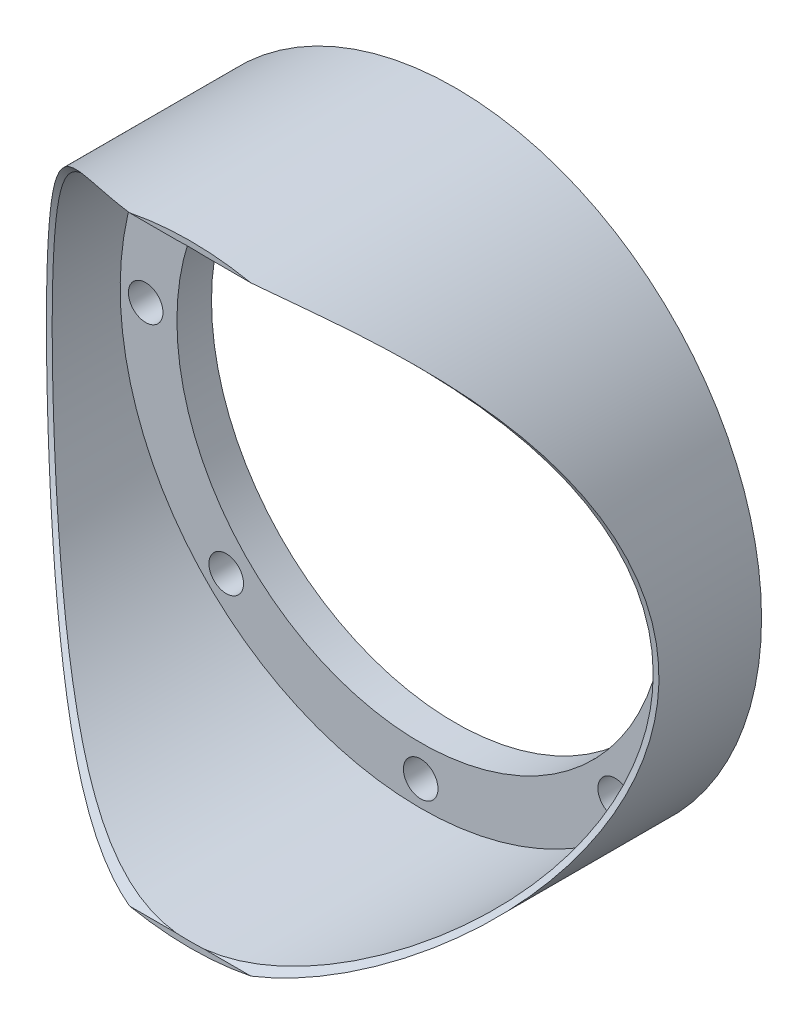
from build123d import *

# Parameters (mm, degrees)
SKETCH1_R           = 265.7
SKETCH1_R_2         = 211.5
SKETCH1_R_3         = 20
SKETCH1_R_4         = 5
EXTRUDE1_DEPTH      = 5
SKETCH2_R           = 265.7
SKETCH2_R_2         = 15
SKETCH2_R_3         = 211.5
EXTRUDE2_DEPTH      = 25
SKETCH3_R           = 265.7
SKETCH3_R_2         = 260.7
EXTRUDE3_DEPTH      = 200
EXTRUDE4_DEPTH      = 441.559848375
EXTRUDE4_DEPTH_BACK = 441.559848375
SKETCH4_R           = 311


with BuildPart() as part:
    # Sketch1 → Extrude1 (new body)
    with BuildSketch(Plane.XY):
        Circle(SKETCH1_R)
        Circle(SKETCH1_R_2, mode=Mode.SUBTRACT)
        with Locations((238.6, 0)):
            Circle(SKETCH1_R_3, mode=Mode.SUBTRACT)
        with Locations((168.715677991, 168.715677991)):
            Circle(SKETCH1_R_3, mode=Mode.SUBTRACT)
        with Locations((0, 238.6)):
            Circle(SKETCH1_R_3, mode=Mode.SUBTRACT)
        with Locations((-168.715677991, 168.715677991)):
            Circle(SKETCH1_R_3, mode=Mode.SUBTRACT)
        with Locations((-238.6, 0)):
            Circle(SKETCH1_R_3, mode=Mode.SUBTRACT)
        with Locations((-168.715677991, -168.715677991)):
            Circle(SKETCH1_R_3, mode=Mode.SUBTRACT)
        with Locations((0, -238.6)):
            Circle(SKETCH1_R_3, mode=Mode.SUBTRACT)
        with Locations((168.715677991, -168.715677991)):
            Circle(SKETCH1_R_3, mode=Mode.SUBTRACT)
        with Locations((230.469902153, 61.754224161)):
            Circle(SKETCH1_R_4, mode=Mode.SUBTRACT)
        with Locations((-230.469902153, 61.754224161)):
            Circle(SKETCH1_R_4, mode=Mode.SUBTRACT)
        with Locations((-91.308266962, -220.437656457)):
            Circle(SKETCH1_R_4, mode=Mode.SUBTRACT)
    extrude(amount=EXTRUDE1_DEPTH)

    # Sketch2 → Extrude2 (add)
    with BuildSketch(Plane.XY.offset(5)):
        Circle(SKETCH2_R)
        with Locations((238.6, 0)):
            Circle(SKETCH2_R_2, mode=Mode.SUBTRACT)
        with Locations((168.715677991, 168.715677991)):
            Circle(SKETCH2_R_2, mode=Mode.SUBTRACT)
        with Locations((0, 238.6)):
            Circle(SKETCH2_R_2, mode=Mode.SUBTRACT)
        with Locations((-168.715677991, 168.715677991)):
            Circle(SKETCH2_R_2, mode=Mode.SUBTRACT)
        with Locations((-238.6, 0)):
            Circle(SKETCH2_R_2, mode=Mode.SUBTRACT)
        with Locations((-168.715677991, -168.715677991)):
            Circle(SKETCH2_R_2, mode=Mode.SUBTRACT)
        with Locations((0, -238.6)):
            Circle(SKETCH2_R_2, mode=Mode.SUBTRACT)
        with Locations((168.715677991, -168.715677991)):
            Circle(SKETCH2_R_2, mode=Mode.SUBTRACT)
        Circle(SKETCH2_R_3, mode=Mode.SUBTRACT)
    extrude(amount=EXTRUDE2_DEPTH)

    # Sketch3 → Extrude3 (add)
    with BuildSketch(Plane.XY.offset(30)):
        Circle(SKETCH3_R)
        Circle(SKETCH3_R_2, mode=Mode.SUBTRACT)
    extrude(amount=EXTRUDE3_DEPTH)

    # Sketch4 → Extrude4 (cut, two sides: drawn at the far end of the back side and taken through both)
    with BuildSketch(Plane(origin=(0, 0, 0), x_dir=(0, 0, -1), z_dir=(1, 0, 0)).offset(-EXTRUDE4_DEPTH_BACK)):
        with Locations((-400, 0)):
            Circle(SKETCH4_R)
    extrude(amount=EXTRUDE4_DEPTH + EXTRUDE4_DEPTH_BACK, mode=Mode.SUBTRACT)


solid = part.part
